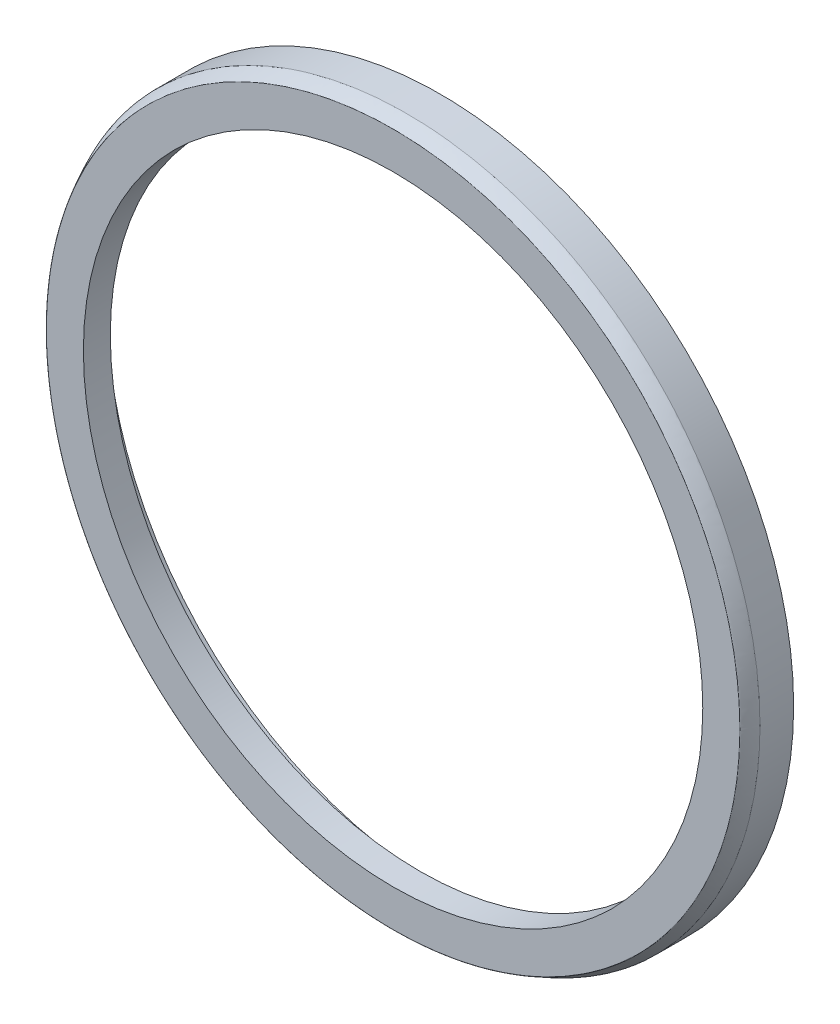
from build123d import *

# Parameters (mm, degrees)
SKETCH3_R           = 52.5
BOSS_EXTRUDE2_DEPTH = 4
BOSS_EXTRUDE3_START = 3
SKETCH4_R           = 52.5
SKETCH4_R_2         = 49.5
BOSS_EXTRUDE3_DEPTH = 3
SKETCH5_R           = 46
CUT_EXTRUDE1_DEPTH  = 10
FILLET1_SIZE        = 2
FILLET1_SIZE_2      = 1


with BuildPart() as part:
    # Sketch3 → Boss-Extrude2 (new body)
    with BuildSketch(Plane.XY):
        Circle(SKETCH3_R)
    extrude(amount=BOSS_EXTRUDE2_DEPTH)

    # Sketch4 → Boss-Extrude3 (add)
    with BuildSketch(Plane(origin=(0, 0, 0), x_dir=(-1, 0, 0), z_dir=(0, 0, -1)).offset(BOSS_EXTRUDE3_START)):
        Circle(SKETCH4_R)
        Circle(SKETCH4_R_2, mode=Mode.SUBTRACT)
    extrude(amount=-BOSS_EXTRUDE3_DEPTH)

    # Sketch5 → Cut-Extrude1 (cut)
    with BuildSketch(Plane(origin=(0, 0, 0), x_dir=(-1, 0, 0), z_dir=(0, 0, -1))):
        Circle(SKETCH5_R)
    extrude(amount=-CUT_EXTRUDE1_DEPTH, mode=Mode.SUBTRACT)

    # Fillet1
    # a fillet whose section is not a circle: 2, 1 mm, written as the material it takes off along each edge
    with BuildSketch(Plane(origin=(0, 0, 4), x_dir=(1, 0, 0), z_dir=(0, -1, 0))) as fillet1_piece_1:
        with BuildLine():
            Bezier((52.5, -FILLET1_SIZE), (52.5, 0), (52.5 - FILLET1_SIZE_2, 0), weights=[1, 0.052631579, 1])
            Line((52.5 - FILLET1_SIZE_2, 0), (51.5, 0.04))
            Line((51.5, 0.04), (52.54, 0.04))
            Line((52.54, 0.04), (52.54, -2))
            Line((52.54, -2), (52.5, -FILLET1_SIZE))
        make_face()
    revolve(axis=Axis((0, 0, 4), (0, 0, 1)), mode=Mode.SUBTRACT)


solid = part.part
